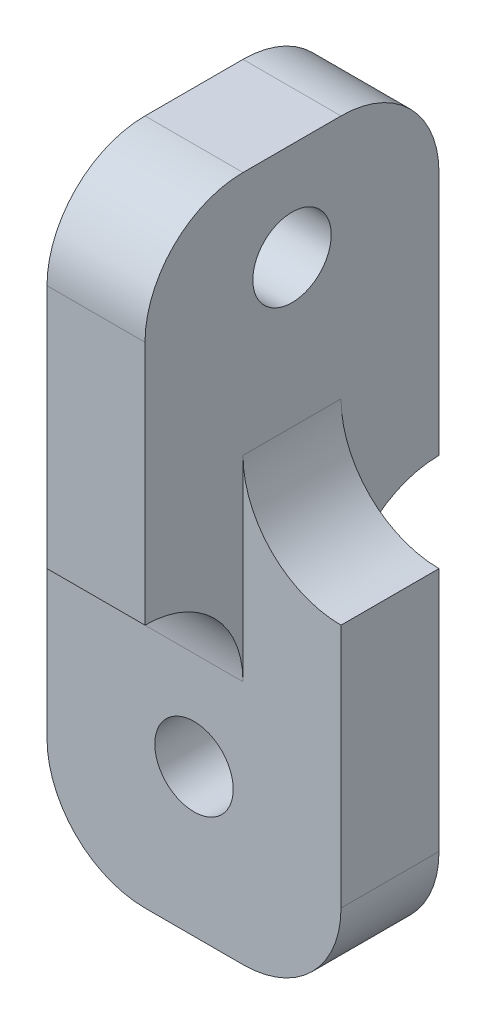
from build123d import *

# Parameters (mm, degrees)
SKETCH1_W           = 30
SKETCH1_H           = 35
BOSS_EXTRUDE1_DEPTH = 10
FILLET1_R           = 10
FILLET2_R           = 10
SKETCH11_R          = 4
CUT_EXTRUDE3_DEPTH  = 14
SKETCH12_W          = 10
SKETCH12_H          = 30
BOSS_EXTRUDE4_DEPTH = 35
SKETCH15_R          = 4
CUT_EXTRUDE4_DEPTH  = 35
FILLET10_R          = 10
FILLET11_R          = 10
FILLET13_R          = 10
FILLET14_R          = 10
FILLET15_R          = 10
FILLET16_R          = 10


with BuildPart() as part:
    # Sketch1 → Boss-Extrude1 (new body)
    with BuildSketch(Plane.XY):
        with Locations((-15, -17.5)):
            Rectangle(SKETCH1_W, SKETCH1_H)
    extrude(amount=BOSS_EXTRUDE1_DEPTH)

    # Fillet1
    fillet1_edges = [part.edges().sort_by_distance(p)[0] for p in [
        (-30, -35, 5),
    ]]
    fillet(fillet1_edges, radius=FILLET1_R)

    # Fillet2
    fillet2_edges = [part.edges().sort_by_distance(p)[0] for p in [
        (0, -35, 5),
    ]]
    fillet(fillet2_edges, radius=FILLET2_R)

    # Sketch11 → Cut-Extrude3 (cut)
    with BuildSketch(Plane.XY):
        with Locations(Location((-15, -20, 0), (0, 0, 180))):
            Circle(SKETCH11_R)
    extrude(amount=CUT_EXTRUDE3_DEPTH, mode=Mode.SUBTRACT)

    # Sketch12 → Boss-Extrude4 (add)
    with BuildSketch(Plane(origin=(0, 0, 0), x_dir=(1, 0, 0), z_dir=(0, 1, 0))):
        with Locations((-15, -5)):
            Rectangle(SKETCH12_W, SKETCH12_H)
    extrude(amount=BOSS_EXTRUDE4_DEPTH)

    # Sketch15 → Cut-Extrude4 (cut)
    with BuildSketch(Plane(origin=(-10, 0, 0), x_dir=(0, 0, -1), z_dir=(1, 0, 0))):
        with Locations((-5, 25)):
            Circle(SKETCH15_R)
    extrude(amount=-CUT_EXTRUDE4_DEPTH, mode=Mode.SUBTRACT)

    # Fillet10
    fillet10_edges = [part.edges().sort_by_distance(p)[0] for p in [
        (-15, 35, -10),
    ]]
    fillet(fillet10_edges, radius=FILLET10_R)

    # Fillet11
    fillet11_edges = [part.edges().sort_by_distance(p)[0] for p in [
        (-15, 35, 20),
    ]]
    fillet(fillet11_edges, radius=FILLET11_R)

    # Fillet13
    fillet13_edges = [part.edges().sort_by_distance(p)[0] for p in [
        (-15, 0, 10),
    ]]
    fillet(fillet13_edges, radius=FILLET13_R - 0.0001)  # a hair under: the kernel refuses the full size

    # Fillet14
    fillet14_edges = [part.edges().sort_by_distance(p)[0] for p in [
        (-15, 0, 0),
    ]]
    fillet(fillet14_edges, radius=FILLET14_R - 0.0001)  # a hair under: the kernel refuses the full size

    # Fillet15
    fillet15_edges = [part.edges().sort_by_distance(p)[0] for p in [
        (-10, 0, 5),
    ]]
    fillet(fillet15_edges, radius=FILLET15_R - 0.0001)  # a hair under: the kernel refuses the full size

    # Fillet16
    fillet16_edges = [part.edges().sort_by_distance(p)[0] for p in [
        (-20, 0, 5),
    ]]
    fillet(fillet16_edges, radius=FILLET16_R - 0.0001)  # a hair under: the kernel refuses the full size


solid = part.part
